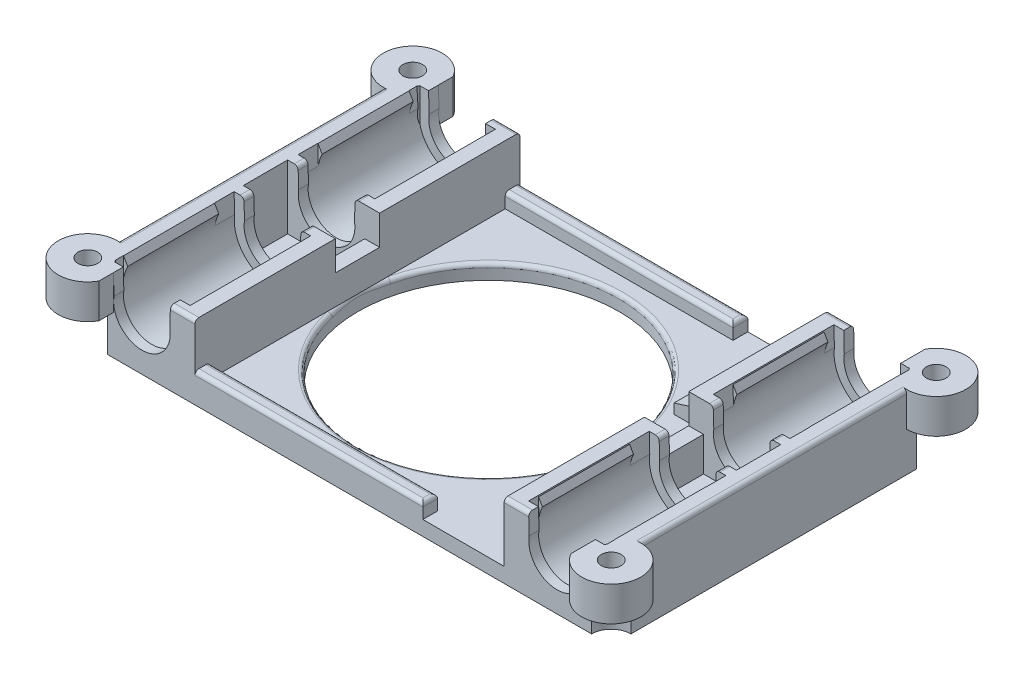
from build123d import *

# Parameters (mm, degrees)
SKETCH1_W               = 124.76
SKETCH1_H               = 66
BOSS_EXTRUDE1_DEPTH     = 20
SKETCH2_R               = 7.75
SKETCH2_R_2             = 7.65
CUT_EXTRUDE1_DEPTH      = 93.990668349
SKETCH4_W               = 62
SKETCH4_H               = 18
CUT_EXTRUDE2_DEPTH      = 27.98
SKETCH5_W               = 62
SKETCH5_H               = 18
CUT_EXTRUDE3_DEPTH      = 27.98
SKETCH6_W               = 22
SKETCH6_H               = 18
SKETCH6_R               = 7.75
BOSS_EXTRUDE2_DEPTH     = 24.5
MIRROR2_COPY_1_SKETCH_W = 22
MIRROR2_COPY_1_SKETCH_H = 18
MIRROR2_COPY_1_SKETCH_R = 7.75
MIRROR2_COPY_1_DEPTH    = 24.5
CUT_EXTRUDE4_DEPTH      = 4
MIRROR4_COPY_1_DEPTH    = 4
CUT_EXTRUDE5_DEPTH      = 4
MIRROR6_COPY_1_DEPTH    = 4
CUT_EXTRUDE6_DEPTH      = 91.195700563
BOSS_EXTRUDE3_DEPTH     = 2
MIRROR11_COPY_1_DEPTH   = 2
BOSS_EXTRUDE4_DEPTH     = 2
MIRROR13_COPY_1_DEPTH   = 2
SKETCH14_W              = 9.22
SKETCH14_H              = 66
CUT_EXTRUDE9_DEPTH      = 74.364559818
SKETCH15_W              = 62.78
SKETCH15_H              = 66
CUT_EXTRUDE10_DEPTH     = 17
SKETCH16_W              = 3.08585698
SKETCH16_H              = 9
BOSS_EXTRUDE6_DEPTH     = 18
SKETCH19_W              = 12
SKETCH19_H              = 2
BOSS_EXTRUDE7_DEPTH     = 8
SKETCH21_R              = 26.5
CUT_EXTRUDE13_DEPTH     = 66.688549992
SKETCH23_W              = 106.32
SKETCH23_H              = 5.5
CUT_EXTRUDE18_DEPTH     = 88.086622608
SKETCH27_W              = 9
SKETCH27_H              = 6.02
CUT_EXTRUDE20_DEPTH     = 6
SKETCH28_W              = 9
SKETCH28_H              = 6.02
CUT_EXTRUDE21_DEPTH     = 6
SKETCH29_W              = 46.27662063
SKETCH29_H              = 3
BOSS_EXTRUDE11_DEPTH    = 3
CUT_EXTRUDE24_DEPTH     = 65.342719868
MIRROR21_COPY_1_DEPTH   = 65.342719868
RIB1_REACH              = 97.02
SKETCH32_WALL_W         = 8.375583562
SKETCH32_WALL_H         = 12
BOSS_EXTRUDE8_DEPTH     = 8
LPATTERN1_COUNT         = 3
LPATTERN1_PITCH         = 2
LPATTERN1_COL_COUNT     = 3
LPATTERN1_COL_PITCH     = 2
MIRROR23_COPY_1_DEPTH   = 8
MIRROR23_COPY_2_DEPTH   = 8
MIRROR23_COPY_3_DEPTH   = 8
MIRROR23_COPY_4_DEPTH   = 8
CUT_EXTRUDE27_REACH     = 65.906
SKETCH40_R              = 2.375
BOSS_EXTRUDE14_START    = -7
SKETCH44_R              = 2
BOSS_EXTRUDE14_DEPTH    = 7
FILLET1_R               = 0.8
FILLET2_R               = 0.8


with BuildPart() as part:
    # Sketch1 → Boss-Extrude1 (new body)
    with BuildSketch(Plane(origin=(0, 0, 0), x_dir=(1, 0, 0), z_dir=(0, 1, 0))):
        Rectangle(SKETCH1_W, SKETCH1_H)
    extrude(amount=BOSS_EXTRUDE1_DEPTH)

    # Sketch2 → Cut-Extrude1 (cut, through all)
    with BuildSketch(Plane.XY.offset(33)):
        with Locations((-42.16, 10)):
            Circle(SKETCH2_R)
        with Locations((42.16, 10)):
            Circle(SKETCH2_R_2)
    extrude(amount=-CUT_EXTRUDE1_DEPTH, mode=Mode.SUBTRACT)

    # Sketch4 → Cut-Extrude2 (cut)
    with BuildSketch(Plane.ZY.offset(62.38)):
        with Locations((0, 11)):
            Rectangle(SKETCH4_W, SKETCH4_H)
    extrude(amount=-CUT_EXTRUDE2_DEPTH, mode=Mode.SUBTRACT)

    # Sketch5 → Cut-Extrude3 (cut)
    with BuildSketch(Plane(origin=(62.38, 0, 0), x_dir=(0, 0, -1), z_dir=(1, 0, 0))):
        with Locations((0, 11)):
            Rectangle(SKETCH5_W, SKETCH5_H)
    extrude(amount=-CUT_EXTRUDE3_DEPTH, mode=Mode.SUBTRACT)

    # Sketch6 → Boss-Extrude2 (add)
    with BuildSketch(Plane(origin=(0, 0, 31), x_dir=(-1, 0, 0), z_dir=(0, 0, -1))):
        with Locations((42.16, 11)):
            Rectangle(SKETCH6_W, SKETCH6_H)
        with Locations(Location((42.16, 10, 0), (0, 0, 180))):
            Circle(SKETCH6_R, mode=Mode.SUBTRACT)
    boss_extrude2 = extrude(amount=BOSS_EXTRUDE2_DEPTH)

    # Mirror1: Boss-Extrude2 across plane
    add(boss_extrude2.mirror(Plane.XY))

    # Mirror2: Boss-Extrude2 across plane
    add(boss_extrude2.mirror(Plane(origin=(0, 0, 0), x_dir=(0, 0, 1), z_dir=(1, 0, 0))))

    # Mirror2 copy 1 sketch → Mirror2 copy 1 (add)
    with BuildSketch(Plane.XY.offset(-31)):
        with Locations((42.16, 11)):
            Rectangle(MIRROR2_COPY_1_SKETCH_W, MIRROR2_COPY_1_SKETCH_H)
        with Locations(Location((42.16, 10, 0), (0, 0, 180))):
            Circle(MIRROR2_COPY_1_SKETCH_R, mode=Mode.SUBTRACT)
    extrude(amount=MIRROR2_COPY_1_DEPTH)

    # Sketch7 → Cut-Extrude4 (cut)
    with BuildSketch(Plane.XY.offset(33)):
        with BuildLine():
            Line((34.512614826, 9.8), (34.24585698, 20))
            Line((34.24585698, 20), (50.07414302, 20))
            Line((50.07414302, 20), (49.807385174, 9.8))
            ThreePointArc((49.807385174, 9.8), (42.16, 2.35), (34.512614826, 9.8))
        make_face()
    cut_extrude4 = extrude(amount=-CUT_EXTRUDE4_DEPTH, mode=Mode.SUBTRACT)

    # Mirror3: Cut-Extrude4 across plane
    add(cut_extrude4.mirror(Plane(origin=(0, 0, 0), x_dir=(0, 0, 1), z_dir=(1, 0, 0))), mode=Mode.SUBTRACT)

    # Mirror4: Cut-Extrude4 across plane
    add(cut_extrude4.mirror(Plane.XY), mode=Mode.SUBTRACT)

    # Mirror4 copy 1 sketch → Mirror4 copy 1 (cut)
    with BuildSketch(Plane(origin=(0, 0, -33), x_dir=(-1, 0, 0), z_dir=(0, 0, -1))):
        with BuildLine():
            Line((34.512614826, 9.8), (34.24585698, 20))
            Line((34.24585698, 20), (50.07414302, 20))
            Line((50.07414302, 20), (49.807385174, 9.8))
            ThreePointArc((49.807385174, 9.8), (42.16, 2.35), (34.512614826, 9.8))
        make_face()
    extrude(amount=-MIRROR4_COPY_1_DEPTH, mode=Mode.SUBTRACT)

    # Sketch8 → Cut-Extrude5 (cut)
    with BuildSketch(Plane.XY.offset(-6.5)):
        with BuildLine():
            Line((49.807385174, 9.8), (50.07414302, 20))
            Line((50.07414302, 20), (34.24585698, 20))
            Line((34.24585698, 20), (34.512614826, 9.8))
            ThreePointArc((34.512614826, 9.8), (42.16, 2.35), (49.807385174, 9.8))
        make_face()
    cut_extrude5 = extrude(amount=-CUT_EXTRUDE5_DEPTH, mode=Mode.SUBTRACT)

    # Mirror5: Cut-Extrude5 across plane
    add(cut_extrude5.mirror(Plane(origin=(0, 0, 0), x_dir=(0, 0, 1), z_dir=(1, 0, 0))), mode=Mode.SUBTRACT)

    # Mirror6: Cut-Extrude5 across plane
    add(cut_extrude5.mirror(Plane.XY), mode=Mode.SUBTRACT)

    # Mirror6 copy 1 sketch → Mirror6 copy 1 (cut)
    with BuildSketch(Plane(origin=(0, 0, 6.5), x_dir=(-1, 0, 0), z_dir=(0, 0, -1))):
        with BuildLine():
            Line((49.807385174, 9.8), (50.07414302, 20))
            Line((50.07414302, 20), (34.24585698, 20))
            Line((34.24585698, 20), (34.512614826, 9.8))
            ThreePointArc((34.512614826, 9.8), (42.16, 2.35), (49.807385174, 9.8))
        make_face()
    extrude(amount=-MIRROR6_COPY_1_DEPTH, mode=Mode.SUBTRACT)

    # Sketch10 → Cut-Extrude6 (cut, symmetric)
    with BuildSketch(Plane(origin=(0, 0, -29), x_dir=(-1, 0, 0), z_dir=(0, 0, -1))):
        with BuildLine():
            Line((34.383752035, 14.727316998), (35.174846415, 13.357101338))
            ThreePointArc((35.174846415, 13.357101338), (42.059363333, 17.74934657), (49.055618814, 13.537363591))
            Line((49.055618814, 13.537363591), (49.945434164, 15.078568986))
            Line((49.945434164, 15.078568986), (50.07414302, 20))
            Line((50.07414302, 20), (34.24585698, 20))
            Line((34.24585698, 20), (34.383752035, 14.727316998))
        make_face()
    cut_extrude6 = extrude(amount=CUT_EXTRUDE6_DEPTH, both=True, mode=Mode.SUBTRACT)

    # Mirror7: Cut-Extrude6 across plane
    add(cut_extrude6.mirror(Plane(origin=(0, 0, 0), x_dir=(0, 0, 1), z_dir=(1, 0, 0))), mode=Mode.SUBTRACT)

    # Sketch12 → Boss-Extrude3 (add)
    with BuildSketch(Plane(origin=(0, 0, -33), x_dir=(-1, 0, 0), z_dir=(0, 0, -1))):
        with BuildLine():
            Line((48.074826635, 20.052287582), (62.38, 20))
            Line((62.38, 20), (62.38, 0))
            Line((62.38, 0), (30.802582176, 0))
            Line((30.802582176, 0), (30.802582176, 20))
            Line((30.802582176, 20), (36.245173365, 20.052287582))
            Line((36.245173365, 20.052287582), (36.484017281, 10.919630457))
            ThreePointArc((36.484017281, 10.919630457), (42.16, 4.25), (47.835982719, 10.919630457))
            Line((47.835982719, 10.919630457), (48.074826635, 20.052287582))
        make_face()
    boss_extrude3 = extrude(amount=-BOSS_EXTRUDE3_DEPTH)

    # Mirror10: Boss-Extrude3 across plane
    add(boss_extrude3.mirror(Plane(origin=(0, 0, 0), x_dir=(0, 0, 1), z_dir=(1, 0, 0))))

    # Mirror11: Boss-Extrude3 across plane
    add(boss_extrude3.mirror(Plane.XY))

    # Mirror11 copy 1 sketch → Mirror11 copy 1 (add)
    with BuildSketch(Plane.XY.offset(33)):
        with BuildLine():
            Line((48.074826635, 20.052287582), (62.38, 20))
            Line((62.38, 20), (62.38, 0))
            Line((62.38, 0), (30.802582176, 0))
            Line((30.802582176, 0), (30.802582176, 20))
            Line((30.802582176, 20), (36.245173365, 20.052287582))
            Line((36.245173365, 20.052287582), (36.484017281, 10.919630457))
            ThreePointArc((36.484017281, 10.919630457), (42.16, 4.25), (47.835982719, 10.919630457))
            Line((47.835982719, 10.919630457), (48.074826635, 20.052287582))
        make_face()
    extrude(amount=-MIRROR11_COPY_1_DEPTH)

    # Sketch13 → Boss-Extrude4 (add)
    with BuildSketch(Plane(origin=(0, 0, 6.5), x_dir=(-1, 0, 0), z_dir=(0, 0, -1))):
        with BuildLine():
            Line((48.074826635, 20.052287582), (47.835982719, 10.919630457))
            ThreePointArc((47.835982719, 10.919630457), (42.16, 4.25), (36.484017281, 10.919630457))
            Line((36.484017281, 10.919630457), (36.245173365, 20.052287582))
            Line((36.245173365, 20.052287582), (28.78, 20))
            Line((28.78, 20), (28.78, 2))
            Line((28.78, 2), (53.16, 2))
            Line((53.16, 2), (53.16, 20))
            Line((53.16, 20), (50.07414302, 20))
            Line((50.07414302, 20), (48.074826635, 20.052287582))
        make_face()
    boss_extrude4 = extrude(amount=BOSS_EXTRUDE4_DEPTH)

    # Mirror12: Boss-Extrude4 across plane
    add(boss_extrude4.mirror(Plane(origin=(0, 0, 0), x_dir=(0, 0, 1), z_dir=(1, 0, 0))))

    # Mirror13: Boss-Extrude4 across plane
    add(boss_extrude4.mirror(Plane.XY))

    # Mirror13 copy 1 sketch → Mirror13 copy 1 (add)
    with BuildSketch(Plane.XY.offset(-6.5)):
        with BuildLine():
            Line((48.074826635, 20.052287582), (47.835982719, 10.919630457))
            ThreePointArc((47.835982719, 10.919630457), (42.16, 4.25), (36.484017281, 10.919630457))
            Line((36.484017281, 10.919630457), (36.245173365, 20.052287582))
            Line((36.245173365, 20.052287582), (28.78, 20))
            Line((28.78, 20), (28.78, 2))
            Line((28.78, 2), (53.16, 2))
            Line((53.16, 2), (53.16, 20))
            Line((53.16, 20), (50.07414302, 20))
            Line((50.07414302, 20), (48.074826635, 20.052287582))
        make_face()
    extrude(amount=MIRROR13_COPY_1_DEPTH)

    # Sketch14 → Cut-Extrude9 (cut, through all)
    with BuildSketch(Plane.XZ):
        with Locations((57.77, 0)):
            Rectangle(SKETCH14_W, SKETCH14_H)
    cut_extrude9 = extrude(amount=-CUT_EXTRUDE9_DEPTH, mode=Mode.SUBTRACT)

    # Mirror15: Cut-Extrude9 across plane
    add(cut_extrude9.mirror(Plane(origin=(0, 0, 0), x_dir=(0, 0, 1), z_dir=(1, 0, 0))), mode=Mode.SUBTRACT)

    # Sketch15 → Cut-Extrude10 (cut)
    with BuildSketch(Plane(origin=(0, 20, 0), x_dir=(1, 0, 0), z_dir=(0, 1, 0))):
        with Locations((0.01, 0)):
            Rectangle(SKETCH15_W, SKETCH15_H)
    extrude(amount=-CUT_EXTRUDE10_DEPTH, mode=Mode.SUBTRACT)

    # Sketch16 → Boss-Extrude6 (add)
    with BuildSketch(Plane(origin=(0, 2, 0), x_dir=(1, 0, 0), z_dir=(0, 1, 0))):
        with Locations((-51.61707151, 0)):
            Rectangle(SKETCH16_W, SKETCH16_H)
    boss_extrude6 = extrude(amount=BOSS_EXTRUDE6_DEPTH)

    # Mirror16: Boss-Extrude6 across plane
    add(boss_extrude6.mirror(Plane(origin=(0, 0, 0), x_dir=(0, 0, 1), z_dir=(1, 0, 0))))

    # Sketch19 → Boss-Extrude7 (add)
    with BuildSketch(Plane.ZY.offset(-31.4)):
        with Locations((-15.5, 5.5)):
            Rectangle(SKETCH19_W, SKETCH19_H)
    boss_extrude7 = extrude(amount=BOSS_EXTRUDE7_DEPTH)

    # Mirror19: Boss-Extrude7 across plane
    add(boss_extrude7.mirror(Plane.XY))

    # Sketch21 → Cut-Extrude13 (cut, through all)
    with BuildSketch(Plane(origin=(0, 20, 0), x_dir=(1, 0, 0), z_dir=(0, 1, 0))):
        with Locations(Location((-4.77, 0, 0), (0, 0, 270))):
            Circle(SKETCH21_R)
    extrude(amount=-CUT_EXTRUDE13_DEPTH, mode=Mode.SUBTRACT)

    # Sketch23 → Cut-Extrude18 (cut, through all)
    with BuildSketch(Plane.XY.offset(33)):
        with Locations((0, 17.75)):
            Rectangle(SKETCH23_W, SKETCH23_H)
    extrude(amount=-CUT_EXTRUDE18_DEPTH, mode=Mode.SUBTRACT)

    # Sketch27 → Cut-Extrude20 (cut)
    with BuildSketch(Plane(origin=(-31.38, 0, 0), x_dir=(0, 0, -1), z_dir=(1, 0, 0))):
        with Locations((0, 11.99)):
            Rectangle(SKETCH27_W, SKETCH27_H)
    extrude(amount=-CUT_EXTRUDE20_DEPTH, mode=Mode.SUBTRACT)

    # Sketch28 → Cut-Extrude21 (cut)
    with BuildSketch(Plane(origin=(34.4, 0, 0), x_dir=(0, 0, -1), z_dir=(1, 0, 0))):
        with Locations((0, 11.99)):
            Rectangle(SKETCH28_W, SKETCH28_H)
    extrude(amount=-CUT_EXTRUDE21_DEPTH, mode=Mode.SUBTRACT)

    # Sketch29 → Boss-Extrude11 (add)
    with BuildSketch(Plane(origin=(0, 3, 0), x_dir=(1, 0, 0), z_dir=(0, 1, 0))):
        with Locations((-8.241689685, 31.5)):
            Rectangle(SKETCH29_W, SKETCH29_H)
        with Locations((-8.241689685, -31.5)):
            Rectangle(SKETCH29_W, SKETCH29_H)
    extrude(amount=BOSS_EXTRUDE11_DEPTH)

    # Sketch30 → Cut-Extrude24 (cut, through all)
    with BuildSketch(Plane.XZ):
        with BuildLine():
            Line((-53.16, 33), (-49.16, 33))
            ThreePointArc((-49.16, 33), (-50.331572875, 30.171572875), (-53.16, 29))
            Line((-53.16, 29), (-53.16, 33))
        make_face()
    cut_extrude24 = extrude(amount=-CUT_EXTRUDE24_DEPTH, mode=Mode.SUBTRACT)

    # Mirror20: Cut-Extrude24 across plane
    add(cut_extrude24.mirror(Plane.XY), mode=Mode.SUBTRACT)

    # Mirror21: Cut-Extrude24 across plane
    add(cut_extrude24.mirror(Plane(origin=(0, 0, 0), x_dir=(0, 0, 1), z_dir=(1, 0, 0))), mode=Mode.SUBTRACT)

    # Mirror21 copy 1 sketch → Mirror21 copy 1 (cut, through all)
    with BuildSketch(Plane(origin=(0, 0, 0), x_dir=(-1, 0, 0), z_dir=(0, -1, 0))):
        with BuildLine():
            Line((-53.16, 33), (-49.16, 33))
            ThreePointArc((-49.16, 33), (-50.331572875, 30.171572875), (-53.16, 29))
            Line((-53.16, 29), (-53.16, 33))
        make_face()
    extrude(amount=-MIRROR21_COPY_1_DEPTH, mode=Mode.SUBTRACT)

    # Sketch32 wall → Rib1 (add, up to next)
    with BuildSketch(Plane(origin=(27.4, 7.74, 9.5), x_dir=(0.955157326174, 0.296098771114, 0), z_dir=(-0.296098771114, 0.955157326174, 0)), mode=Mode.PRIVATE) as rib1_sk1:
        with Locations((0, -6)):
            Rectangle(SKETCH32_WALL_W, SKETCH32_WALL_H)
    rib1_tool1 = extrude(rib1_sk1.sketch, amount=-RIB1_REACH, mode=Mode.PRIVATE) - part.part
    rib1 = rib1_tool1.solids().sort_by_distance((27.4, 7.74, 9.5))[0]
    add(rib1)

    # Mirror22: Rib1 across plane
    add(rib1.mirror(Plane.XY))

    # Sketch36 → Boss-Extrude8 (add)
    with BuildSketch(Plane.ZY.offset(-31.4)):
        with BuildLine():
            Line((15.014979482, 4.11689212), (14.919167075, 4.5))
            Line((14.919167075, 4.5), (16.080832925, 4.5))
            Line((16.080832925, 4.5), (15.985020518, 4.11689212))
            ThreePointArc((15.985020518, 4.11689212), (15.5, 3.738233523), (15.014979482, 4.11689212))
        make_face()
    boss_extrude8 = extrude(amount=BOSS_EXTRUDE8_DEPTH)

    # LPattern1: Boss-Extrude8 ×3
    with Locations(*[(0, 0, i * LPATTERN1_PITCH) for i in range(1, LPATTERN1_COUNT)]):
        add(boss_extrude8)

    # LPattern1 col: Boss-Extrude8 ×3
    with Locations(*[(0, 0, -i * LPATTERN1_COL_PITCH) for i in range(1, LPATTERN1_COL_COUNT)]):
        add(boss_extrude8)

    # Mirror23: Boss-Extrude8 across plane
    add(boss_extrude8.mirror(Plane.XY))

    # Mirror23 copy 1 sketch → Mirror23 copy 1 (add)
    with BuildSketch(Plane(origin=(31.4, 0, -2), x_dir=(0, 0, -1), z_dir=(-1, 0, 0))):
        with BuildLine():
            Line((15.014979482, -4.11689212), (14.919167075, -4.5))
            Line((14.919167075, -4.5), (16.080832925, -4.5))
            Line((16.080832925, -4.5), (15.985020518, -4.11689212))
            ThreePointArc((15.985020518, -4.11689212), (15.5, -3.738233523), (15.014979482, -4.11689212))
        make_face()
    extrude(amount=MIRROR23_COPY_1_DEPTH)

    # Mirror23 copy 2 sketch → Mirror23 copy 2 (add)
    with BuildSketch(Plane(origin=(31.4, 0, -4), x_dir=(0, 0, -1), z_dir=(-1, 0, 0))):
        with BuildLine():
            Line((15.014979482, -4.11689212), (14.919167075, -4.5))
            Line((14.919167075, -4.5), (16.080832925, -4.5))
            Line((16.080832925, -4.5), (15.985020518, -4.11689212))
            ThreePointArc((15.985020518, -4.11689212), (15.5, -3.738233523), (15.014979482, -4.11689212))
        make_face()
    extrude(amount=MIRROR23_COPY_2_DEPTH)

    # Mirror23 copy 3 sketch → Mirror23 copy 3 (add)
    with BuildSketch(Plane(origin=(31.4, 0, 2), x_dir=(0, 0, -1), z_dir=(-1, 0, 0))):
        with BuildLine():
            Line((15.014979482, -4.11689212), (14.919167075, -4.5))
            Line((14.919167075, -4.5), (16.080832925, -4.5))
            Line((16.080832925, -4.5), (15.985020518, -4.11689212))
            ThreePointArc((15.985020518, -4.11689212), (15.5, -3.738233523), (15.014979482, -4.11689212))
        make_face()
    extrude(amount=MIRROR23_COPY_3_DEPTH)

    # Mirror23 copy 4 sketch → Mirror23 copy 4 (add)
    with BuildSketch(Plane(origin=(31.4, 0, 4), x_dir=(0, 0, -1), z_dir=(-1, 0, 0))):
        with BuildLine():
            Line((15.014979482, -4.11689212), (14.919167075, -4.5))
            Line((14.919167075, -4.5), (16.080832925, -4.5))
            Line((16.080832925, -4.5), (15.985020518, -4.11689212))
            ThreePointArc((15.985020518, -4.11689212), (15.5, -3.738233523), (15.014979482, -4.11689212))
        make_face()
    extrude(amount=MIRROR23_COPY_4_DEPTH)

    # Sketch40 → Cut-Extrude27 (cut, up to next)
    with BuildSketch(Plane(origin=(0, 2, 0), x_dir=(1, 0, 0), z_dir=(0, 1, 0)), mode=Mode.PRIVATE) as cut_extrude27_sk1:
        with Locations(Location((42.23914302, 0, 0), (0, 0, 270))):
            Circle(SKETCH40_R)
    cut_extrude27_tool1 = extrude(cut_extrude27_sk1.sketch, amount=-CUT_EXTRUDE27_REACH, mode=Mode.PRIVATE) & part.part
    # Sketch40 → Cut-Extrude27 (cut, up to next)
    with BuildSketch(Plane(origin=(0, 2, 0), x_dir=(1, 0, 0), z_dir=(0, 1, 0)), mode=Mode.PRIVATE) as cut_extrude27_sk2:
        with Locations(Location((-42.23914302, 0, 0), (0, 0, 270))):
            Circle(SKETCH40_R)
    cut_extrude27_tool2 = extrude(cut_extrude27_sk2.sketch, amount=-CUT_EXTRUDE27_REACH, mode=Mode.PRIVATE) & part.part
    add(cut_extrude27_tool1.solids().sort_by_distance((42.239143, 2, 0))[0], mode=Mode.SUBTRACT)
    add(cut_extrude27_tool2.solids().sort_by_distance((-42.239143, 2, 0))[0], mode=Mode.SUBTRACT)

    # Sketch44 → Boss-Extrude14 (add)
    # profile 1 of 4: a face of its own
    with BuildSketch(Plane(origin=(0, 15, 0), x_dir=(1, 0, 0), z_dir=(0, 1, 0)).offset(BOSS_EXTRUDE14_START)):
        with BuildLine():
            Line((-47.942695522, -33), (-49.16, -33))
            ThreePointArc((-49.16, -33), (-50.331572875, -30.171572875), (-53.16, -29))
            Line((-53.16, -29), (-53.16, -27))
            ThreePointArc((-53.16, -27), (-58.345478258, -36.018412701), (-47.942695522, -35.963061589))
            Line((-47.942695522, -35.963061589), (-47.942695522, -33))
        make_face()
        with Locations(Location((-53.16, -33, 0), (0, 0, 180))):
            Circle(SKETCH44_R, mode=Mode.SUBTRACT)
    # profile 2 of 4: a face of its own
    with BuildSketch(Plane(origin=(0, 15, 0), x_dir=(1, 0, 0), z_dir=(0, 1, 0)).offset(BOSS_EXTRUDE14_START)):
        with BuildLine():
            Line((49.16, -33), (47.942695522, -33))
            Line((47.942695522, -33), (47.942695522, -35.963061589))
            ThreePointArc((47.942695522, -35.963061589), (58.345478258, -36.018412701), (53.16, -27))
            Line((53.16, -27), (53.16, -29))
            ThreePointArc((53.16, -29), (50.331572875, -30.171572875), (49.16, -33))
        make_face()
        with Locations(Location((53.16, -33, 0), (0, 0, 180))):
            Circle(SKETCH44_R, mode=Mode.SUBTRACT)
    # profile 3 of 4: a face of its own
    with BuildSketch(Plane(origin=(0, 15, 0), x_dir=(1, 0, 0), z_dir=(0, 1, 0)).offset(BOSS_EXTRUDE14_START)):
        with BuildLine():
            Line((47.942695522, 35.963061589), (47.942695522, 33))
            Line((47.942695522, 33), (49.16, 33))
            ThreePointArc((49.16, 33), (50.331572875, 30.171572875), (53.16, 29))
            Line((53.16, 29), (53.16, 27))
            ThreePointArc((53.16, 27), (58.345478258, 36.018412701), (47.942695522, 35.963061589))
        make_face()
        with Locations(Location((53.16, 33, 0), (0, 0, 180))):
            Circle(SKETCH44_R, mode=Mode.SUBTRACT)
    # profile 4 of 4: a face of its own
    with BuildSketch(Plane(origin=(0, 15, 0), x_dir=(1, 0, 0), z_dir=(0, 1, 0)).offset(BOSS_EXTRUDE14_START)):
        with BuildLine():
            ThreePointArc((-47.942695522, 35.963061589), (-58.345478258, 36.018412701), (-53.16, 27))
            Line((-53.16, 27), (-53.16, 29))
            ThreePointArc((-53.16, 29), (-50.331572875, 30.171572875), (-49.16, 33))
            Line((-49.16, 33), (-47.942695522, 33))
            Line((-47.942695522, 33), (-47.942695522, 35.963061589))
        make_face()
        with Locations(Location((-53.16, 33, 0), (0, 0, 180))):
            Circle(SKETCH44_R, mode=Mode.SUBTRACT)
    extrude(amount=BOSS_EXTRUDE14_DEPTH)

    # Fillet1
    fillet1_edges = [part.edges().sort_by_distance(p)[0] for p in [
        (33.888652239, 15, 33),
        (-53.16, 15, 0),
        (53.16, 15, 0),
        (-33.878652239, 15, 33),
        (33.888652239, 15, -33),
        (-33.878652239, 15, -33),
    ]]
    fillet(fillet1_edges, radius=FILLET1_R)

    # Fillet2
    fillet2_edges = [part.edges().sort_by_distance(p)[0] for p in [
        (-8.241689685, 6, 30),
        (-8.241689685, 6, 33),
        (14.89662063, 6, 31.5),
        (-8.241689685, 6, -30),
        (14.89662063, 6, -31.5),
        (-8.241689685, 6, -33),
        (-4.77, 3, -26.5),
        (36.377304478, 15, -5.5),
        (-36.377304478, 15, 5.5),
        (36.377304478, 15, 5.5),
        (47.942695522, 15, 5.5),
        (-47.942695522, 15, -5.5),
        (-36.377304478, 15, -5.5),
        (47.942695522, 15, -5.5),
        (-47.942695522, 15, 5.5),
    ]]
    fillet(fillet2_edges, radius=FILLET2_R)


solid = part.part
